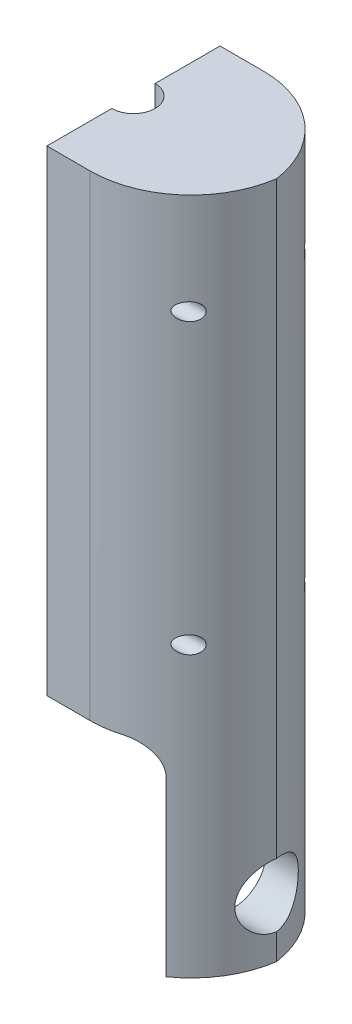
from build123d import *

# Parameters (mm, degrees)
BOSS_EXTRU_1_DEPTH            = 60
CONG_4_R                      = 35
CONG_5_R                      = 35
CONG_6_R                      = 35
CONG_12_R                     = 10
ESQUISSE3_R                   = 11
ENL_V_MAT_EXTRU_4_DEPTH       = 50
ENL_V_MAT_EXTRU_8_DEPTH       = 251
ESQUISSE6_R                   = 2
ENL_V_MAT_EXTRU_9_DEPTH       = 58
ENL_V_MAT_EXTRU_12_DEPTH      = 243.825514624
ENL_V_MAT_EXTRU_12_DEPTH_BACK = 179
COQUE1_T                      = -5
ESQUISSE11_R                  = 3
ENL_V_MAT_EXTRU_14_DEPTH      = 20
BOSS_EXTRU_2_DEPTH            = 5


with BuildPart() as part:
    # Esquisse1 → Boss.-Extru.1 (new body)
    with BuildSketch(Plane.XY):
        Polygon((-50, 160), (-50, -70), (-35, -70), (-35, 0), (35, 0), (35, -70), (50, -70), (50, 160), align=None)
    extrude(amount=BOSS_EXTRU_1_DEPTH)

    # Congé4
    cong_4_edges = [part.edges().sort_by_distance(p)[0] for p in [
        (-50, 45, 60),
    ]]
    fillet(cong_4_edges, radius=CONG_4_R)

    # Congé5
    # the kernel refuses this fillet: 35 mm, written as the material it takes off along each edge
    with BuildSketch(Plane(origin=(-50, 243.852549156, 0), x_dir=(0, 0, 1), z_dir=(0, -1, 0))) as cong_5_piece_1:
        with BuildLine():
            CenterArc((35, -33.541019662), CONG_5_R, 106.601549599, 73.398450401)
            Line((0, -33.541019662), (-0.7, -33.541019662))
            Line((-0.7, -33.541019662), (-0.7, 0))
            Line((-0.7, 0), (0, 0.7))
            ThreePointArc((0, 0.7), (12.5, 0.7), (24.8, 0.670820393))
            Line((24.8, 0.670820393), (25, 0))
        make_face()
    extrude(amount=397.705098312, mode=Mode.SUBTRACT)

    # Congé6
    # the kernel refuses this fillet: 35 mm, written as the material it takes off along each edge
    with BuildSketch(Plane(origin=(50, -157.5, 0), x_dir=(-1, 0, 0), z_dir=(0, 1, 0))) as cong_6_piece_1:
        with BuildLine():
            CenterArc((CONG_6_R, CONG_6_R), CONG_6_R, 180, 90)
            Line((0, CONG_6_R), (0, 0))
            Line((0, 0), (CONG_6_R, 0))
        make_face()
    extrude(amount=405, mode=Mode.SUBTRACT)
    with BuildSketch(Plane(origin=(50, -157.5, 60), x_dir=(-1, 0, 0), z_dir=(0, 1, 0))) as cong_6_piece_2:
        with BuildLine():
            CenterArc((CONG_6_R, -CONG_6_R), CONG_6_R, 90, 90)
            Line((0, -CONG_6_R), (0, 0))
            Line((0, 0), (CONG_6_R, 0))
        make_face()
    extrude(amount=405, mode=Mode.SUBTRACT)

    # Congé12
    cong_12_edges = [part.edges().sort_by_distance(p)[0] for p in [
        (-35, 0, 29.518642471),
        (35, 0, 30),
    ]]
    fillet(cong_12_edges, radius=CONG_12_R)

    # Esquisse3 → Enlèv. mat.-Extru.4 (cut)
    with BuildSketch(Plane.ZY.offset(-35)):
        with Locations(Location((30, -50, 0), (0, 0, 270))):
            Circle(ESQUISSE3_R)
    extrude(amount=-ENL_V_MAT_EXTRU_4_DEPTH, mode=Mode.SUBTRACT)

    # Esquisse5 → Enlèv. mat.-Extru.8 (cut)
    with BuildSketch(Plane(origin=(0, 160, 0), x_dir=(1, 0, 0), z_dir=(0, 1, 0))):
        with BuildLine():
            Line((0, -60), (0, 0))
            ThreePointArc((0, 0), (-70.853503696, -30), (0, -60))
        make_face()
    extrude(amount=-ENL_V_MAT_EXTRU_8_DEPTH, mode=Mode.SUBTRACT)

    # Esquisse6 → Enlèv. mat.-Extru.9 (cut)
    with BuildSketch(Plane.ZY):
        with Locations((10, 130)):
            Circle(ESQUISSE6_R)
        with Locations((50, 130)):
            Circle(ESQUISSE6_R)
        with Locations((50, 30)):
            Circle(ESQUISSE6_R)
        with Locations((10, 30)):
            Circle(ESQUISSE6_R)
    extrude(amount=-ENL_V_MAT_EXTRU_9_DEPTH, mode=Mode.SUBTRACT)

    # Esquisse9 → Enlèv. mat.-Extru.12 (cut, two sides: drawn at the far end of the back side and taken through both)
    with BuildSketch(Plane(origin=(0, 160, 0), x_dir=(1, 0, 0), z_dir=(0, 1, 0)).offset(-ENL_V_MAT_EXTRU_12_DEPTH_BACK)):
        with BuildLine():
            Line((-134.426371834, -22.5), (0, -22.5))
            ThreePointArc((0, -22.5), (7.5, -30), (0, -37.5))
            Line((0, -37.5), (-134.426371834, -37.5))
            Line((-134.426371834, -37.5), (-403.279115503, -37.5))
            Line((-403.279115503, -37.5), (-403.279115503, -22.5))
            Line((-403.279115503, -22.5), (-134.426371834, -22.5))
        make_face()
    extrude(amount=ENL_V_MAT_EXTRU_12_DEPTH + ENL_V_MAT_EXTRU_12_DEPTH_BACK, mode=Mode.SUBTRACT)

    # Coque1
    coque1_openings = [part.faces().sort_by_distance(p)[0] for p in [
        (22.0354716, 160, 30),
    ]]
    offset(amount=COQUE1_T, openings=coque1_openings)

    # Esquisse11 → Enlèv. mat.-Extru.14 (cut)
    with BuildSketch(Plane.ZY.offset(-49.641016151)):
        with Locations(Location((50, 130, 0), (0, 0, 180))):
            Circle(ESQUISSE11_R)
        with Locations(Location((10, 130, 0), (0, 0, 180))):
            Circle(ESQUISSE11_R)
        with Locations(Location((50, 30, 0), (0, 0, 180))):
            Circle(ESQUISSE11_R)
        with Locations(Location((10, 30, 0), (0, 0, 180))):
            Circle(ESQUISSE11_R)
    extrude(amount=ENL_V_MAT_EXTRU_14_DEPTH, mode=Mode.SUBTRACT)

    # Esquisse12 → Boss.-Extru.2 (add)
    with BuildSketch(Plane(origin=(0, 160, 0), x_dir=(1, 0, 0), z_dir=(0, 1, 0))):
        with BuildLine():
            Line((15, 0), (0, 0))
            Line((0, 0), (0, -22.5))
            ThreePointArc((0, -22.5), (7.5, -30), (0, -37.5))
            Line((0, -37.5), (0, -60))
            Line((0, -60), (15, -60))
            ThreePointArc((15, -60), (37.912878475, -51.457513111), (49.641016151, -30))
            ThreePointArc((49.641016151, -30), (37.912878475, -8.542486889), (15, 0))
        make_face()
    extrude(amount=BOSS_EXTRU_2_DEPTH)


solid = part.part
